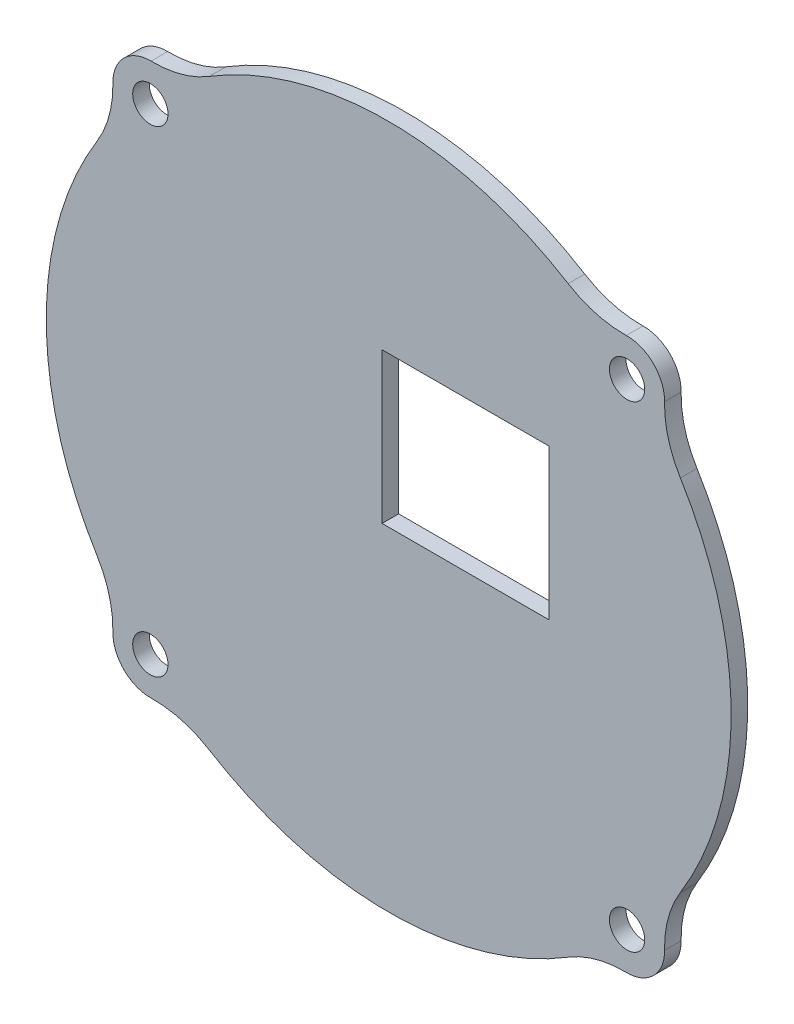
from build123d import *

# Parameters (mm, degrees)
ESQUISSE1_R             = 1.65
BOSS_EXTRU_1_DEPTH      = 1.55
CONG_1_R                = 10
ESQUISSE3_W             = 15.619459358
ESQUISSE3_H             = 14.055120746
ENL_V_MAT_EXTRU_1_DEPTH = 46.281370486


with BuildPart() as part:
    # Esquisse1 → Boss.-Extru.1 (new body)
    with BuildSketch(Plane.XY):
        with BuildLine():
            ThreePointArc((-24.957906965, 20.02755302), (-32, 0), (-24.957906965, -20.02755302))
            ThreePointArc((-24.957906965, -20.02755302), (-24.748737342, -24.748737342), (-20.02755302, -24.957906965))
            ThreePointArc((-20.02755302, -24.957906965), (0, -32), (20.02755302, -24.957906965))
            ThreePointArc((20.02755302, -24.957906965), (24.748737342, -24.748737342), (24.957906965, -20.02755302))
            ThreePointArc((24.957906965, -20.02755302), (32, 0), (24.957906965, 20.02755302))
            ThreePointArc((24.957906965, 20.02755302), (24.748737342, 24.748737342), (20.02755302, 24.957906965))
            ThreePointArc((20.02755302, 24.957906965), (0, 32), (-20.02755302, 24.957906965))
            ThreePointArc((-20.02755302, 24.957906965), (-24.748737342, 24.748737342), (-24.957906965, 20.02755302))
        make_face()
        with Locations((-22.273863607, 22.273863607)):
            Circle(ESQUISSE1_R, mode=Mode.SUBTRACT)
        with Locations((22.273863607, 22.273863607)):
            Circle(ESQUISSE1_R, mode=Mode.SUBTRACT)
        with Locations((22.273863607, -22.273863607)):
            Circle(ESQUISSE1_R, mode=Mode.SUBTRACT)
        with Locations((-22.273863607, -22.273863607)):
            Circle(ESQUISSE1_R, mode=Mode.SUBTRACT)
    extrude(amount=BOSS_EXTRU_1_DEPTH)

    # Congé1
    cong_1_edges = [part.edges().sort_by_distance(p)[0] for p in [
        (24.957906965, -20.02755302, 0.775),
        (20.02755302, -24.957906965, 0.775),
        (-20.02755302, -24.957906965, 0.775),
        (-24.957906965, -20.02755302, 0.775),
        (-24.957906965, 20.02755302, 0.775),
        (-20.02755302, 24.957906965, 0.775),
        (20.02755302, 24.957906965, 0.775),
        (24.957906965, 20.02755302, 0.775),
    ]]
    fillet(cong_1_edges, radius=CONG_1_R)

    # Esquisse3 → Enlèv. mat.-Extru.1 (cut, through all)
    with BuildSketch(Plane.XY.offset(1.55)):
        with Locations((7.190270321, 6.180965917)):
            Rectangle(ESQUISSE3_W, ESQUISSE3_H)
    extrude(amount=-ENL_V_MAT_EXTRU_1_DEPTH, mode=Mode.SUBTRACT)


solid = part.part
